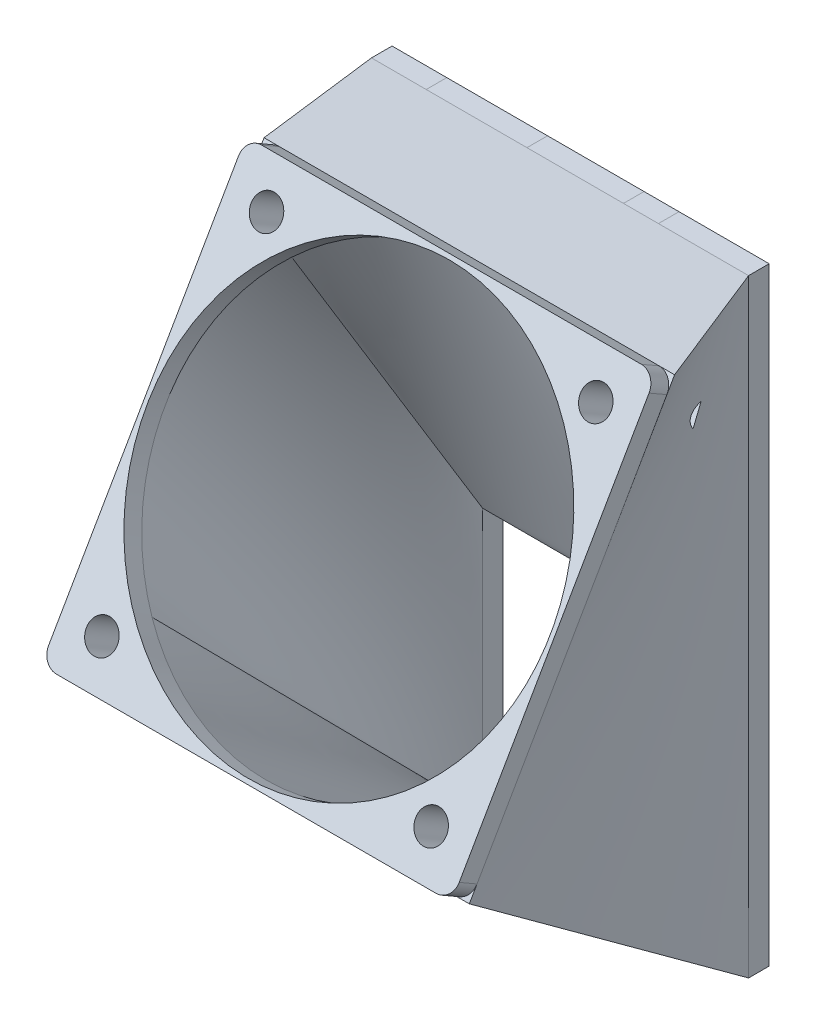
from build123d import *

# Parameters (mm, degrees)
BOSS_EXTRUDE1_DEPTH = 2
SKETCH3_R           = 19.555
BOSS_EXTRUDE3_DEPTH = 2
SKETCH10_R          = 1.5
CUT_EXTRUDE1_DEPTH  = 10
BOSS_EXTRUDE4_START = 2
SKETCH11_R          = 2.25
SKETCH11_R_2        = 1.5
BOSS_EXTRUDE4_DEPTH = 2


with BuildPart() as part:
    # Sketch1 → Boss-Extrude1 (new body)
    with BuildSketch(Plane.XY):
        with BuildLine():
            Line((-41.607184222, -168.647205393), (-46.587139734, -168.647205393))
            Line((-46.587139734, -168.647205393), (-56.379772227, -168.647214346))
            Line((-56.379772227, -168.647214346), (-58.979752441, -168.647214346))
            Line((-58.979752441, -168.647214346), (-61.699393133, -168.647214346))
            Line((-61.699393133, -168.647214346), (-61.699393133, -196.747191902))
            ThreePointArc((-61.699393133, -196.747191902), (-62.43162618, -198.514958855), (-64.199393133, -199.247191902))
            Line((-64.199393133, -199.247191902), (-61.699393133, -199.247191902))
            Line((-61.699393133, -199.247191902), (-61.699393133, -203.247191902))
            Line((-61.699393133, -203.247191902), (-64.199393133, -203.247191902))
            ThreePointArc((-64.199393133, -203.247191902), (-62.43162618, -203.979424949), (-61.699393133, -205.747191902))
            Line((-61.699393133, -205.747191902), (-61.699393133, -227.763094952))
            Line((-61.699393133, -227.763094952), (-50.655931604, -227.763094952))
            Line((-50.655931604, -227.763094952), (-28.158436841, -227.763094952))
            Line((-28.158436841, -227.763094952), (-25.049620936, -227.763094952))
            Line((-25.049620936, -227.763094952), (-25.049620936, -168.647196959))
            Line((-25.049620936, -168.647196959), (-33.809543561, -168.647205393))
            Line((-33.809543561, -168.647205393), (-37.207184222, -168.647203189))
            Line((-37.207184222, -168.647203189), (-41.607184222, -168.647205393))
        make_face()
        Polygon((-50.655931604, -226.763094952), (-50.907184222, -226.763094952), (-50.907184222, -201.147191902), (-45.907184222, -201.147191902), (-32.907184222, -201.147191902), (-27.907184222, -201.147191902), (-27.907184222, -226.763094952), (-28.158436841, -226.763094952), align=None, mode=Mode.SUBTRACT)
    extrude(amount=BOSS_EXTRUDE1_DEPTH)



with BuildPart() as body_2:
    # Sketch3 → Boss-Extrude3 (new body)
    with BuildSketch(Plane(origin=(0, -34.549914252, -59.842206881), x_dir=(-1, 0, 0), z_dir=(0, -0.500000000000004, -0.8660254037844363))):
        with BuildLine():
            Line((20.957184222, -192.615202808), (26.332184222, -192.615202808))
            Line((26.332184222, -192.615202808), (28.207184222, -192.615202808))
            Line((28.207184222, -192.615202808), (30.057184222, -192.615202808))
            Line((30.057184222, -192.615202808), (52.482184222, -192.615202808))
            Line((52.482184222, -192.615202808), (57.857184222, -192.615202808))
            ThreePointArc((57.857184222, -192.615202808), (58.917844394, -192.17586298), (59.357184222, -191.115202808))
            Line((59.357184222, -191.115202808), (59.357184222, -185.740202808))
            Line((59.357184222, -185.740202808), (59.357184222, -159.590202808))
            Line((59.357184222, -159.590202808), (59.357184222, -154.215202808))
            ThreePointArc((59.357184222, -154.215202808), (58.917844394, -153.154542636), (57.857184222, -152.715202808))
            Line((57.857184222, -152.715202808), (52.482184222, -152.715202808))
            Line((52.482184222, -152.715202808), (26.332184222, -152.715202808))
            Line((26.332184222, -152.715202808), (20.957184222, -152.715202808))
            ThreePointArc((20.957184222, -152.715202808), (19.89652405, -153.154542636), (19.457184222, -154.215202808))
            Line((19.457184222, -154.215202808), (19.457184222, -159.590202808))
            Line((19.457184222, -159.590202808), (19.457184222, -185.740202808))
            Line((19.457184222, -185.740202808), (19.457184222, -191.115202808))
            ThreePointArc((19.457184222, -191.115202808), (19.89652405, -192.17586298), (20.957184222, -192.615202808))
        make_face()
        with Locations(Location((39.407184222, -172.665202808, 0), (0, 0, 270))):
            Circle(SKETCH3_R, mode=Mode.SUBTRACT)
        with BuildLine():
            ThreePointArc((53.157184222, -188.665202808), (55.407184222, -190.915202808), (57.657184222, -188.665202808))
            ThreePointArc((57.657184222, -188.665202808), (55.407184222, -186.415202808), (53.157184222, -188.665202808))
        make_face(mode=Mode.SUBTRACT)
        with BuildLine():
            ThreePointArc((53.157184222, -156.665202808), (55.407184222, -158.915202808), (57.657184222, -156.665202808))
            ThreePointArc((57.657184222, -156.665202808), (55.407184222, -154.415202808), (53.157184222, -156.665202808))
        make_face(mode=Mode.SUBTRACT)
        with BuildLine():
            ThreePointArc((21.157184222, -188.665202808), (23.407184222, -190.915202808), (25.657184222, -188.665202808))
            ThreePointArc((25.657184222, -188.665202808), (23.407184222, -186.415202808), (21.157184222, -188.665202808))
        make_face(mode=Mode.SUBTRACT)
        with BuildLine():
            ThreePointArc((21.157184222, -156.665202808), (23.407184222, -158.915202808), (25.657184222, -156.665202808))
            ThreePointArc((25.657184222, -156.665202808), (23.407184222, -154.415202808), (21.157184222, -156.665202808))
        make_face(mode=Mode.SUBTRACT)
    extrude(amount=BOSS_EXTRUDE3_DEPTH)


with BuildPart() as part_1:
    add(part.part)

    add(body_2.part)  # Loft1 merges body 2
    # Sketch6 → Loft1 section 0
    with BuildSketch(Plane(origin=(0, -35.549914252, -61.574257689), x_dir=(-1, 0, 0), z_dir=(0, -0.5000000000000042, -0.8660254037844362))):
        with BuildLine():
            Line((19.457184222, -152.715202808), (59.357184222, -152.715202808))
            Line((59.357184222, -152.715202808), (59.357184222, -192.615202808))
            Line((59.357184222, -192.615202808), (19.457184222, -192.615202808))
            Line((19.457184222, -192.615202808), (19.457184222, -152.715202808))
        make_face()
    # Sketch5 → Loft1 section 1
    with BuildSketch(Plane.XY.offset(2)):
        with BuildLine():
            Line((-61.699393133, -168.647214346), (-25.049620936, -168.647214346))
            Line((-25.049620936, -168.647214346), (-25.049620936, -227.763094952))
            Line((-25.049620936, -227.763094952), (-61.699393133, -227.763094952))
            Line((-61.699393133, -227.763094952), (-61.699393133, -168.647214346))
        make_face()
    loft()

    # Cut-Loft1: read off the stored shape, not the designer's step
    # Cut-Loft1: loft between two sections, ruled curve by curve
    cut_loft1_from = [
        Edge.make_bspline([(-53.482072433, -173.325595412, 17.970568917), (-52.667812044, -172.594487517, 17.548463577), (-51.745338218, -171.898626452, 17.146708004), (-49.694764128, -170.639104746, 16.419522808), (-48.566526461, -170.075877129, 16.094343191), (-46.145670861, -169.143122954, 15.555817318), (-44.853245437, -168.774093393, 15.342758001), (-42.176030481, -168.275981497, 15.055172964), (-40.79177962, -168.147239462, 14.980843715), (-38.022588825, -168.147239462, 14.980843715), (-36.638337963, -168.275981497, 15.055172964), (-33.961123008, -168.774093393, 15.342758001), (-32.668697584, -169.143122954, 15.555817318), (-30.247841983, -170.075877129, 16.094343191), (-29.119604317, -170.639104746, 16.419522808), (-27.069030226, -171.898626452, 17.146708004), (-26.146556401, -172.594487517, 17.548463577), (-25.332296011, -173.325595412, 17.970568917)], [0, 0, 0, 0, 0.125, 0.125, 0.25, 0.25, 0.375, 0.375, 0.5, 0.5, 0.625, 0.625, 0.75, 0.75, 0.875, 0.875, 1, 1, 1, 1], 3),
        Edge.make_bspline([(-25.332296011, -173.325595412, 17.970568917), (-24.546923358, -174.030765595, 18.377699112), (-23.80453356, -174.820503558, 18.833654538), (-22.467581287, -176.557388485, 19.836445518), (-21.873425062, -177.5046005, 20.38331863), (-20.892767461, -179.522748872, 21.548497135), (-20.506707178, -180.593531168, 22.166713582), (-19.986269086, -182.803834674, 23.442832907), (-19.852184222, -183.942984641, 24.100521447), (-19.852184222, -186.221747825, 25.416165984), (-19.986269086, -187.360897792, 26.073854524), (-20.506707178, -189.571201298, 27.349973849), (-20.892767461, -190.641983594, 27.968190295), (-21.873425062, -192.660131966, 29.133368801), (-22.467581287, -193.607343981, 29.680241913), (-23.80453356, -195.344228908, 30.683032893), (-24.546923358, -196.133966872, 31.138988319), (-25.332296011, -196.839137054, 31.546118514)], [0, 0, 0, 0, 0.125, 0.125, 0.25, 0.25, 0.375, 0.375, 0.5, 0.5, 0.625, 0.625, 0.75, 0.75, 0.875, 0.875, 1, 1, 1, 1], 3),
        Edge.make_bspline([(-53.482072433, -196.839137054, 31.546118514), (-54.267445087, -196.133966872, 31.138988319), (-55.009834884, -195.344228908, 30.683032893), (-56.346787158, -193.607343981, 29.680241913), (-56.940943382, -192.660131966, 29.133368801), (-57.921600984, -190.641983594, 27.968190295), (-58.307661266, -189.571201298, 27.349973849), (-58.828099359, -187.360897792, 26.073854524), (-58.962184222, -186.221747825, 25.416165984), (-58.962184222, -183.942984641, 24.100521447), (-58.828099359, -182.803834674, 23.442832907), (-58.307661266, -180.593531168, 22.166713582), (-57.921600984, -179.522748872, 21.548497135), (-56.940943382, -177.5046005, 20.38331863), (-56.346787158, -176.557388485, 19.836445518), (-55.009834884, -174.820503558, 18.833654538), (-54.267445087, -174.030765595, 18.377699112), (-53.482072433, -173.325595412, 17.970568917)], [0, 0, 0, 0, 0.125, 0.125, 0.25, 0.25, 0.375, 0.375, 0.5, 0.5, 0.625, 0.625, 0.75, 0.75, 0.875, 0.875, 1, 1, 1, 1], 3),
        Edge.make_bspline([(-25.332296011, -196.839137054, 31.546118514), (-26.146556401, -197.570244949, 31.968223854), (-27.069030226, -198.266106014, 32.369979427), (-29.119604317, -199.52562772, 33.097164623), (-30.247841983, -200.088855337, 33.422344239), (-32.668697584, -201.021609512, 33.960870113), (-33.961123008, -201.390639073, 34.17392943), (-36.638337963, -201.888750969, 34.461514467), (-38.022588825, -202.017493004, 34.535843715), (-40.79177962, -202.017493004, 34.535843715), (-42.176030481, -201.888750969, 34.461514467), (-44.853245437, -201.390639073, 34.17392943), (-46.145670861, -201.021609512, 33.960870113), (-48.566526461, -200.088855337, 33.422344239), (-49.694764128, -199.52562772, 33.097164623), (-51.745338218, -198.266106014, 32.369979427), (-52.667812044, -197.570244949, 31.968223854), (-53.482072433, -196.839137054, 31.546118514)], [0, 0, 0, 0, 0.125, 0.125, 0.25, 0.25, 0.375, 0.375, 0.5, 0.5, 0.625, 0.625, 0.75, 0.75, 0.875, 0.875, 1, 1, 1, 1], 3),
    ]
    cut_loft1_to = [
        Edge.make_bspline([(-50.907184222, -201.147191902, 2), (-49.948850889, -201.147191902, 2), (-48.990517556, -201.147191902, 2), (-47.073850889, -201.147191902, 2), (-46.115517556, -201.147191902, 2), (-44.198850889, -201.147191902, 2), (-43.240517556, -201.147191902, 2), (-41.323850889, -201.147191902, 2), (-40.365517556, -201.147191902, 2), (-38.448850889, -201.147191902, 2), (-37.490517556, -201.147191902, 2), (-35.573850889, -201.147191902, 2), (-34.615517556, -201.147191902, 2), (-32.698850889, -201.147191902, 2), (-31.740517556, -201.147191902, 2), (-29.823850889, -201.147191902, 2), (-28.865517556, -201.147191902, 2), (-27.907184222, -201.147191902, 2)], [0, 0, 0, 0, 0.125, 0.125, 0.25, 0.25, 0.375, 0.375, 0.5, 0.5, 0.625, 0.625, 0.75, 0.75, 0.875, 0.875, 1, 1, 1, 1], 3),
        Edge.make_bspline([(-27.907184222, -201.147191902, 2), (-27.907184222, -202.214521196, 2), (-27.907184222, -203.28185049, 2), (-27.907184222, -205.416509077, 2), (-27.907184222, -206.483838371, 2), (-27.907184222, -208.618496958, 2), (-27.907184222, -209.685826252, 2), (-27.907184222, -211.820484839, 2), (-27.907184222, -212.887814133, 2), (-27.907184222, -215.022472721, 2), (-27.907184222, -216.089802014, 2), (-27.907184222, -218.224460602, 2), (-27.907184222, -219.291789896, 2), (-27.907184222, -221.426448483, 2), (-27.907184222, -222.493777777, 2), (-27.907184222, -224.628436364, 2), (-27.907184222, -225.695765658, 2), (-27.907184222, -226.763094952, 2)], [0, 0, 0, 0, 0.125, 0.125, 0.25, 0.25, 0.375, 0.375, 0.5, 0.5, 0.625, 0.625, 0.75, 0.75, 0.875, 0.875, 1, 1, 1, 1], 3),
        Edge.make_bspline([(-50.907184222, -226.763094952, 2), (-50.907184222, -225.695765658, 2), (-50.907184222, -224.628436364, 2), (-50.907184222, -222.493777777, 2), (-50.907184222, -221.426448483, 2), (-50.907184222, -219.291789896, 2), (-50.907184222, -218.224460602, 2), (-50.907184222, -216.089802014, 2), (-50.907184222, -215.022472721, 2), (-50.907184222, -212.887814133, 2), (-50.907184222, -211.820484839, 2), (-50.907184222, -209.685826252, 2), (-50.907184222, -208.618496958, 2), (-50.907184222, -206.483838371, 2), (-50.907184222, -205.416509077, 2), (-50.907184222, -203.28185049, 2), (-50.907184222, -202.214521196, 2), (-50.907184222, -201.147191902, 2)], [0, 0, 0, 0, 0.125, 0.125, 0.25, 0.25, 0.375, 0.375, 0.5, 0.5, 0.625, 0.625, 0.75, 0.75, 0.875, 0.875, 1, 1, 1, 1], 3),
        Edge.make_bspline([(-27.907184222, -226.763094952, 2), (-28.865517556, -226.763094952, 2), (-29.823850889, -226.763094952, 2), (-31.740517556, -226.763094952, 2), (-32.698850889, -226.763094952, 2), (-34.615517556, -226.763094952, 2), (-35.573850889, -226.763094952, 2), (-37.490517556, -226.763094952, 2), (-38.448850889, -226.763094952, 2), (-40.365517556, -226.763094952, 2), (-41.323850889, -226.763094952, 2), (-43.240517556, -226.763094952, 2), (-44.198850889, -226.763094952, 2), (-46.115517556, -226.763094952, 2), (-47.073850889, -226.763094952, 2), (-48.990517556, -226.763094952, 2), (-49.948850889, -226.763094952, 2), (-50.907184222, -226.763094952, 2)], [0, 0, 0, 0, 0.125, 0.125, 0.25, 0.25, 0.375, 0.375, 0.5, 0.5, 0.625, 0.625, 0.75, 0.75, 0.875, 0.875, 1, 1, 1, 1], 3),
    ]
    cut_loft1 = Solid(Shell([*[Face.make_surface_from_curves(cut_loft1_from[k], cut_loft1_to[k]) for k in range(4)], Face(Wire(cut_loft1_from)), Face(Wire(cut_loft1_to))]))
    add(cut_loft1, mode=Mode.SUBTRACT)

    # Sketch10 → Cut-Extrude1 (cut)
    with BuildSketch(Plane(origin=(0, -34.549914252, -59.842206881), x_dir=(1, 0, 0), z_dir=(0, 0.5000000000000042, 0.8660254037844362))):
        with Locations(Location((-55.407184222, -156.665202808, 0), (0, 0, 270))):
            Circle(SKETCH10_R)
        with Locations(Location((-23.407184222, -156.665202808, 0), (0, 0, 324.794812126))):
            Circle(SKETCH10_R)
        with Locations(Location((-23.407184222, -188.665202808, 0), (0, 0, 270))):
            Circle(SKETCH10_R)
        with Locations(Location((-55.407184222, -188.665202808, 0), (0, 0, 270))):
            Circle(SKETCH10_R)
    extrude(amount=-CUT_EXTRUDE1_DEPTH, mode=Mode.SUBTRACT)

    # Sketch11 → Boss-Extrude4 (add)
    # profile 1 of 4: a face of its own
    with BuildSketch(Plane(origin=(0, -35.549914252, -61.574257689), x_dir=(1, 0, 0), z_dir=(0, 0.5000000000000046, 0.8660254037844362)).offset(BOSS_EXTRUDE4_START)):
        with Locations((-55.407184222, -156.665202808)):
            Circle(SKETCH11_R)
        with Locations(Location((-55.407184222, -156.665202808, 0), (0, 0, 270))):
            Circle(SKETCH11_R_2, mode=Mode.SUBTRACT)
    # profile 2 of 4: a face of its own
    with BuildSketch(Plane(origin=(0, -35.549914252, -61.574257689), x_dir=(1, 0, 0), z_dir=(0, 0.5000000000000046, 0.8660254037844362)).offset(BOSS_EXTRUDE4_START)):
        with Locations((-23.407184222, -156.665202808)):
            Circle(SKETCH11_R)
        with Locations(Location((-23.407184222, -156.665202808, 0), (0, 0, 324.794812126))):
            Circle(SKETCH11_R_2, mode=Mode.SUBTRACT)
    # profile 3 of 4: a face of its own
    with BuildSketch(Plane(origin=(0, -35.549914252, -61.574257689), x_dir=(1, 0, 0), z_dir=(0, 0.5000000000000046, 0.8660254037844362)).offset(BOSS_EXTRUDE4_START)):
        with Locations((-55.407184222, -188.665202808)):
            Circle(SKETCH11_R)
        with Locations(Location((-55.407184222, -188.665202808, 0), (0, 0, 270))):
            Circle(SKETCH11_R_2, mode=Mode.SUBTRACT)
    # profile 4 of 4: a face of its own
    with BuildSketch(Plane(origin=(0, -35.549914252, -61.574257689), x_dir=(1, 0, 0), z_dir=(0, 0.5000000000000046, 0.8660254037844362)).offset(BOSS_EXTRUDE4_START)):
        with Locations((-23.407184222, -188.665202808)):
            Circle(SKETCH11_R)
        with Locations(Location((-23.407184222, -188.665202808, 0), (0, 0, 270))):
            Circle(SKETCH11_R_2, mode=Mode.SUBTRACT)
    extrude(amount=-BOSS_EXTRUDE4_DEPTH)


solid = part_1.part
